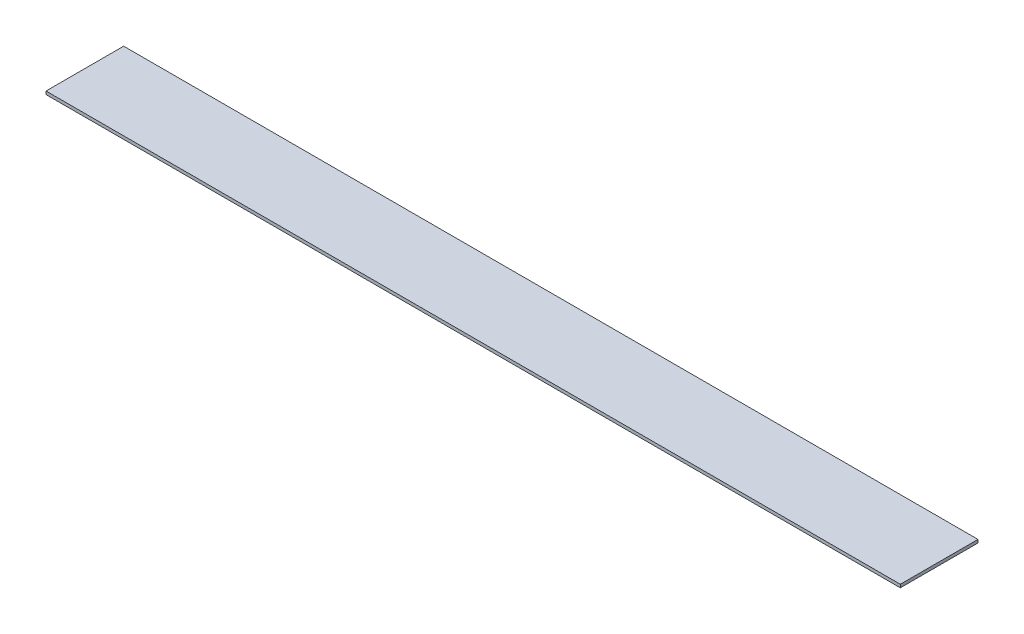
from build123d import *

# Parameters (mm, degrees)
SKETCH1_W           = 69.85
SKETCH1_H           = 6.35
BOSS_EXTRUDE1_DEPTH = 0.254


with BuildPart() as part:
    # Sketch1 → Boss-Extrude1 (new body)
    with BuildSketch(Plane(origin=(0, 0, 0), x_dir=(1, 0, 0), z_dir=(0, 1, 0))):
        Rectangle(SKETCH1_W, SKETCH1_H)
    extrude(amount=BOSS_EXTRUDE1_DEPTH)


solid = part.part
